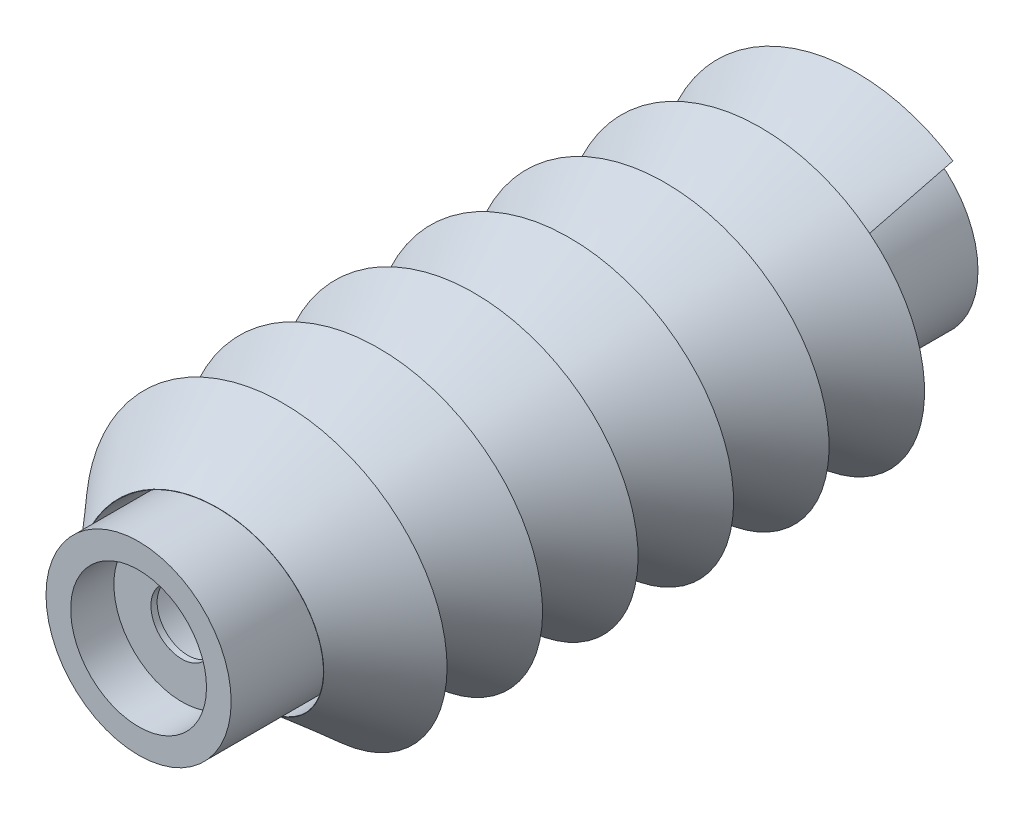
from build123d import *

# Parameters (mm, degrees)
SKETCH_1_R          = 15
SKETCH_1_R_2        = 11
EXTRUDE_1_DEPTH     = 63
SWEEP_1_PITCH       = 15.473846154
SKETCH_12_R         = 15
EXTRUDE_2_DEPTH     = 8
SKETCH_21_W         = 11.005
SKETCH_21_H         = 7
EXTRUDE_START       = 60
SKETCH_34_R         = 15
EXTRUDE_6_DEPTH     = 60
SKETCH_35_W         = 14
SKETCH_35_H         = 50
CUT_EXTRUDE_2_DEPTH = 10
MOVE_FACE_1_BY      = 10
SKETCH_44_W         = 5
SKETCH_44_H         = 20


with BuildPart() as part:
    # Эскиз1 → Бобышка-Вытянуть1 (new body)
    with BuildSketch(Plane.XY):
        Circle(SKETCH_1_R)
        Circle(SKETCH_1_R_2, mode=Mode.SUBTRACT)
    extrude(amount=EXTRUDE_1_DEPTH)

    # Эскиз12 → Бобышка-Вытянуть2 (add)
    with BuildSketch(Plane.XY.offset(63)):
        Circle(SKETCH_12_R)
    extrude(amount=EXTRUDE_2_DEPTH)

    # Эскиз21 → Отверстие1 (revolve, cut)
    with BuildSketch(Plane(origin=(0, 0, 71), x_dir=(0, -1, 0), z_dir=(1, 0, 0))):
        with Locations((5.5025, 3.5)):
            Rectangle(SKETCH_21_W, SKETCH_21_H)
    revolve(axis=Axis((0, 0, -39), (0, 0, 1)), mode=Mode.SUBTRACT)

    # Эскиз34 → Бобышка-Вытянуть6 (add)
    with BuildSketch(Plane(origin=(0, 0, 0), x_dir=(-1, 0, 0), z_dir=(0, 0, -1)).offset(EXTRUDE_START)):
        Circle(SKETCH_34_R)
    extrude(amount=-EXTRUDE_6_DEPTH)

    # Эскиз35 → Отверстие2 (revolve, cut)
    with BuildSketch(Plane(origin=(0, 0, -60), x_dir=(0, 1, 0), z_dir=(1, 0, 0))):
        with Locations((7, 25)):
            Rectangle(SKETCH_35_W, SKETCH_35_H)
    revolve(axis=Axis((0, 0, 50), (0, 0, -1)), mode=Mode.SUBTRACT)

    # Эскиз43 → Вырез-Вытянуть2 (cut)
    with BuildSketch(Plane(origin=(0, 0, -10), x_dir=(-1, 0, 0), z_dir=(0, 0, -1))):
        with BuildLine():
            Line((0.58, 1.914053291), (0.58, -1.914053291))
            ThreePointArc((0.58, -1.914053291), (-2, 0), (0.58, 1.914053291))
        make_face()
    extrude(amount=-CUT_EXTRUDE_2_DEPTH, mode=Mode.SUBTRACT)

    # Move Face 1: a face moved inward by 10.0
    extrude(part.faces().sort_by_distance((7.5, -12, -60))[0], amount=MOVE_FACE_1_BY, dir=(0, 0, 1), mode=Mode.SUBTRACT)

    # Эскиз44 → Отверстие3 (revolve, cut)
    with BuildSketch(Plane(origin=(0, 0, 64), x_dir=(0, -1, 0), z_dir=(1, 0, 0))):
        with Locations((2.5, 10)):
            Rectangle(SKETCH_44_W, SKETCH_44_H)
    revolve(axis=Axis((0, 0, -46), (0, 0, 1)), mode=Mode.SUBTRACT)


with BuildPart() as body_2:
    # По траектории1: the profile of Эскиз7 screwed along a right-hand helix of 6.5 turns, 18 arcs to a turn; built about Z, then put on its axis
    sweep_1_z = Axis((0, 0, 0), (0, 0, 1))
    sweep_1_corners = [(15, 0, 0), (15.738869287, -2.648152091, 16.129309555), (15.783333296, -2.648231163, 16.129791165), (25.270916097, -0.934380103, 5.691102854)]
    with BuildLine(mode=Mode.PRIVATE) as sweep_1_profile:
        Line(sweep_1_corners[0], sweep_1_corners[1])
        Line(sweep_1_corners[1], sweep_1_corners[2])
        Line(sweep_1_corners[2], sweep_1_corners[3])
        Line(sweep_1_corners[3], sweep_1_corners[0])
    sweep_1_cap = Face(sweep_1_profile.wire())
    sweep_1_turn_angles = [0, 10, 20, 30, 40, 50, 60, 70, 80, 90, 100, 110, 120, 130, 140, 150, 160, 170, 180, 190, 200, 210, 220, 230, 240, 250, 260, 270, 280, 290, 300, 310, 320, 330, 340, 350, 360]
    sweep_1_turn_weights = [1, 0.984807753012208, 1, 0.984807753012208, 1, 0.984807753012208, 1, 0.984807753012208, 1, 0.984807753012208, 1, 0.984807753012208, 1, 0.984807753012208, 1, 0.984807753012208, 1, 0.984807753012208, 1, 0.984807753012208, 1, 0.984807753012208, 1, 0.984807753012208, 1, 0.984807753012208, 1, 0.984807753012208, 1, 0.984807753012208, 1, 0.984807753012208, 1, 0.984807753012208, 1, 0.984807753012208, 1]
    sweep_1_turn_rails = [Edge.make_bspline([Vector(p[0], p[1], 0).rotate(sweep_1_z, sweep_1_turn_angles[k]) / sweep_1_turn_weights[k] + Vector(0, 0, p[2] + SWEEP_1_PITCH * sweep_1_turn_angles[k] / 360) for k in range(37)], [0, 0, 0, 1, 1, 2, 2, 3, 3, 4, 4, 5, 5, 6, 6, 7, 7, 8, 8, 9, 9, 10, 10, 11, 11, 12, 12, 13, 13, 14, 14, 15, 15, 16, 16, 17, 17, 18, 18, 18], 2, sweep_1_turn_weights) for p in sweep_1_corners]
    sweep_1_turn_sides = [Face.make_surface_from_curves(sweep_1_turn_rails[p[0]], sweep_1_turn_rails[p[1]]) for p in [(0, 1), (1, 2), (2, 3), (3, 0)]]
    sweep_1_last_angles = [2160, 2170, 2180, 2190, 2200, 2210, 2220, 2230, 2240, 2250, 2260, 2270, 2280, 2290, 2300, 2310, 2320, 2330, 2340]
    sweep_1_last_weights = [1, 0.984807753012208, 1, 0.984807753012208, 1, 0.984807753012208, 1, 0.984807753012208, 1, 0.984807753012208, 1, 0.984807753012208, 1, 0.984807753012208, 1, 0.984807753012208, 1, 0.984807753012208, 1]
    sweep_1_last_rails = [Edge.make_bspline([Vector(p[0], p[1], 0).rotate(sweep_1_z, sweep_1_last_angles[k]) / sweep_1_last_weights[k] + Vector(0, 0, p[2] + SWEEP_1_PITCH * sweep_1_last_angles[k] / 360) for k in range(19)], [0, 0, 0, 1, 1, 2, 2, 3, 3, 4, 4, 5, 5, 6, 6, 7, 7, 8, 8, 9, 9, 9], 2, sweep_1_last_weights) for p in sweep_1_corners]
    sweep_1_last_sides = [Face.make_surface_from_curves(sweep_1_last_rails[p[0]], sweep_1_last_rails[p[1]]) for p in [(0, 1), (1, 2), (2, 3), (3, 0)]]
    sweep_1 = Plane(origin=(0, 0, 0), x_dir=(0.6293203910498425, 0.7771459614569669, 0), z_dir=(0, 0, 1)) * Solid(Shell([*[p.moved(Location((0, 0, SWEEP_1_PITCH * i))) for i in range(6) for p in sweep_1_turn_sides], *sweep_1_last_sides, sweep_1_cap, sweep_1_cap.rotate(sweep_1_z, 2340).moved(Location((0, 0, SWEEP_1_PITCH * 2340 / 360)))]))
    add(sweep_1)


with BuildPart() as body_2_1:
    # Move Body 1: moved
    add(body_2.part.moved(Location((0, 0, -50))))


solid = Compound([part.part, body_2_1.part])
